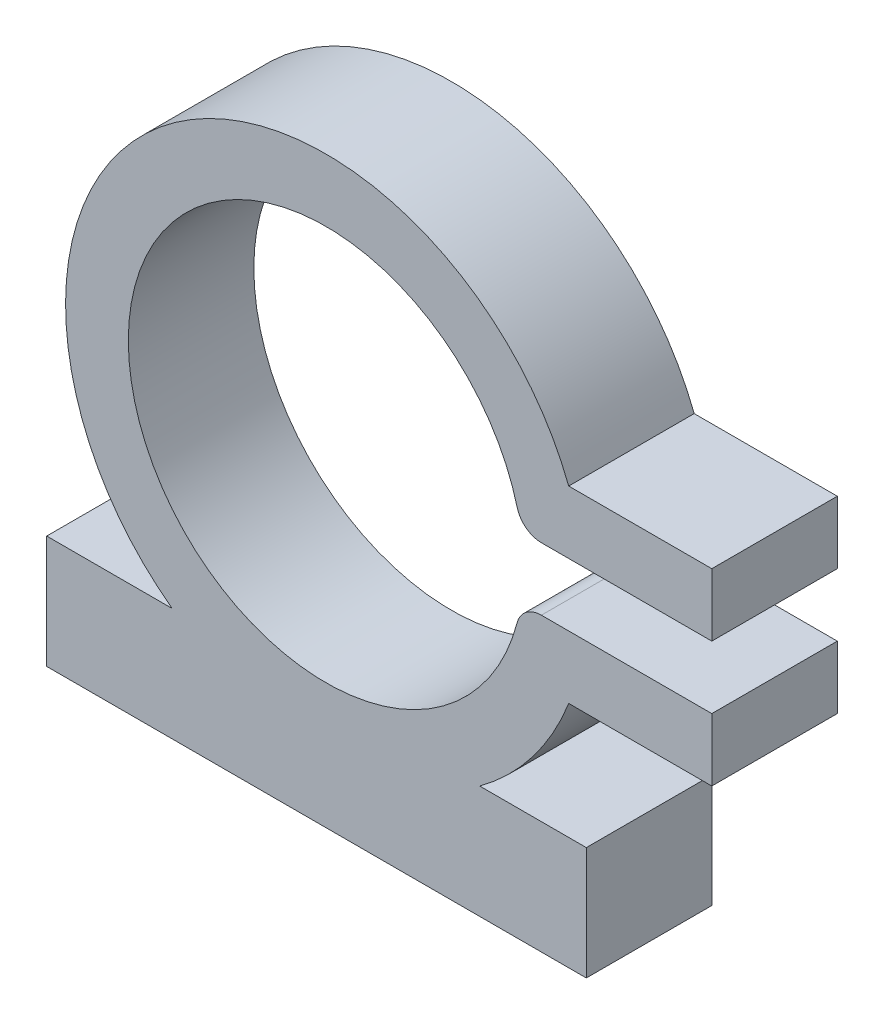
from build123d import *

# Parameters (mm, degrees)
BOSS_EXTRUDE1_DEPTH = 12.7
FILLET2_R           = 2.54


with BuildPart() as part:
    # Sketch1 → Boss-Extrude1 (new body)
    with BuildSketch(Plane.XY):
        with BuildLine():
            Line((19.74637625, 3.175), (39.05, 3.175))
            Line((39.05, 3.175), (39.05, 9.525))
            Line((39.05, 9.525), (24.568208624, 9.525))
            ThreePointArc((24.568208624, 9.525), (-16.043674906, 20.902703067), (-15.553443349, -21.27))
            Line((-15.553443349, -21.27), (-28.26, -21.27))
            Line((-28.26, -21.27), (-28.26, -32.7))
            Line((-28.26, -32.7), (26.35, -32.7))
            Line((26.35, -32.7), (26.35, -21.27))
            Line((26.35, -21.27), (15.553443349, -21.27))
            ThreePointArc((15.553443349, -21.27), (20.902703067, -16.043674906), (24.568208624, -9.525))
            Line((24.568208624, -9.525), (39.05, -9.525))
            Line((39.05, -9.525), (39.05, -3.175))
            Line((39.05, -3.175), (19.74637625, -3.175))
            ThreePointArc((19.74637625, -3.175), (-20, 0), (19.74637625, 3.175))
        make_face()
    extrude(amount=BOSS_EXTRUDE1_DEPTH)

    # Fillet2
    fillet2_edges = [part.edges().sort_by_distance(p)[0] for p in [
        (19.74637625, -3.175, 6.35),
        (19.74637625, 3.175, 6.35),
    ]]
    fillet(fillet2_edges, radius=FILLET2_R)


solid = part.part
